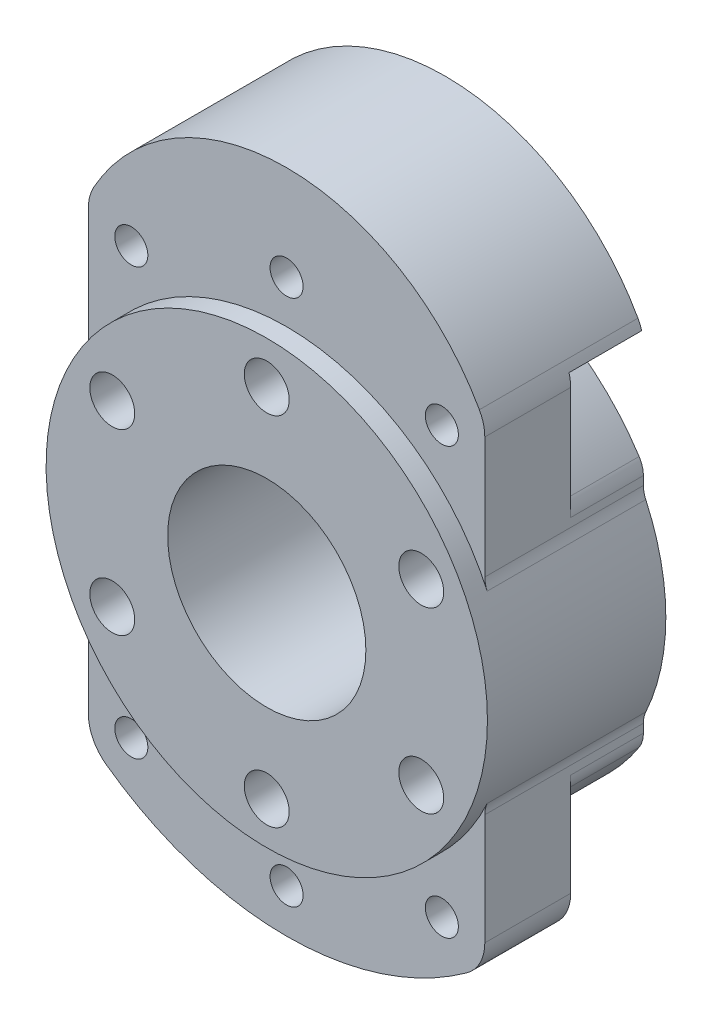
from build123d import *

# Parameters (mm, degrees)
EXTRUDE_1_DEPTH             = 0.7
EXTRUDE_2_DEPTH             = 5.5
EXTRUDE_3_DEPTH             = 6.5
SKETCH_4_R                  = 16.7
EXTRUDE_4_DEPTH             = 1.5
EXTRUDE_5_REACH             = 43.838
EXTRUDE_5_START_RADIUS      = 16.7
EXTRUDE_5_END_RADIUS        = 16.7
SKETCH_5_W                  = 30
SKETCH_5_H                  = 12
CUT_EXTRUDE_1_DEPTH         = 5.5
HOLE_WIZARD_2_5_2_5_1_D     = 2.5
HOLE_WIZARD_2_5_2_5_1_DEPTH = 8
HOLE_WIZARD_15_0_15_1_D     = 15
HOLE_WIZARD_15_0_15_1_DEPTH = 14.2
HOLE_WIZARD_3_4_3_4_1_D     = 3.4
HOLE_WIZARD_3_4_3_4_1_DEPTH = 14.2
FILLET_1_R                  = 0.5
FILLET_2_R                  = 2
FILLET_START                = 2
FILLET_3_DEPTH              = 14


with BuildPart() as part:
    # 草图1 → 凸台-拉伸1 (new body)
    with BuildSketch(Plane(origin=(0, 0, 2.3), x_dir=(-1, 0, 0), z_dir=(0, 0, -1))):
        with BuildLine():
            Line((5.499904708, -20.525923809), (4.529333289, -16.90370196))
            ThreePointArc((4.529333289, -16.90370196), (0, -17.5), (-4.529333289, -16.90370196))
            Line((-4.529333289, -16.90370196), (-5.499904708, -20.525923809))
            ThreePointArc((-5.499904708, -20.525923809), (-3.858782139, -20.896705492), (-2.193469574, -21.136489567))
            ThreePointArc((-2.193469574, -21.136489567), (-1.75352934, -20.954121421), (-1.665889964, -20.486013645))
            ThreePointArc((-1.665889964, -20.486013645), (0, -18.2), (1.665889964, -20.486013645))
            ThreePointArc((1.665889964, -20.486013645), (1.75352934, -20.954121421), (2.193469574, -21.136489567))
            ThreePointArc((2.193469574, -21.136489567), (3.858782139, -20.896705492), (5.499904708, -20.525923809))
        make_face()
    extrude(amount=-EXTRUDE_1_DEPTH)

    # 草图2 → 凸台-拉伸2 (add)
    with BuildSketch(Plane.XY.offset(3)):
        with BuildLine():
            Line((-15, -9.013878189), (-15, -7.340980861))
            ThreePointArc((-15, -7.340980861), (0, 16.7), (15, -7.340980861))
            Line((15, -7.340980861), (15, -9.013878189))
            ThreePointArc((15, -9.013878189), (12.1297479, -12.614246544), (8.419780607, -15.341358953))
            ThreePointArc((8.419780607, -15.341358953), (5.738930413, -14.290719986), (4.529333289, -16.90370196))
            Line((4.529333289, -16.90370196), (5.499904708, -20.525923809))
            ThreePointArc((5.499904708, -20.525923809), (3.858782139, -20.896705492), (2.193469574, -21.136489567))
            ThreePointArc((2.193469574, -21.136489567), (1.75352934, -20.954121421), (1.665889964, -20.486013645))
            ThreePointArc((1.665889964, -20.486013645), (0, -18.2), (-1.665889964, -20.486013645))
            ThreePointArc((-1.665889964, -20.486013645), (-1.75352934, -20.954121421), (-2.193469574, -21.136489567))
            ThreePointArc((-2.193469574, -21.136489567), (-3.858782139, -20.896705492), (-5.499904708, -20.525923809))
            Line((-5.499904708, -20.525923809), (-4.529333289, -16.90370196))
            ThreePointArc((-4.529333289, -16.90370196), (-5.738930413, -14.290719986), (-8.419780607, -15.341358953))
            ThreePointArc((-8.419780607, -15.341358953), (-12.1297479, -12.614246544), (-15, -9.013878189))
        make_face()
    extrude(amount=EXTRUDE_2_DEPTH)

    # 草图3 → 凸台-拉伸3 (add)
    with BuildSketch(Plane.XY.offset(8.5)):
        with BuildLine():
            Line((-15, -17.764078923), (-15, -7.340980861))
            ThreePointArc((-15, -7.340980861), (0, 16.7), (15, -7.340980861))
            Line((15, -7.340980861), (15, -17.764078923))
            ThreePointArc((15, -17.764078923), (0, -23.25), (-15, -17.764078923))
        make_face()
    extrude(amount=EXTRUDE_3_DEPTH)

    # 草图4 → 凸台-拉伸4 (add)
    with BuildSketch(Plane.XY.offset(15)):
        with Locations(Location((0, 0, 0), (0, 0, 206.077066929))):
            Circle(SKETCH_4_R)
    extrude(amount=EXTRUDE_4_DEPTH)

    # 凸台-拉伸5: from a cylinder face, 43.838 long prism both ways, kept between that surface and its translate by the depth
    extrude_5_start = Plane(origin=(0, 0, 9), z_dir=(0, 0, -1)) * Cylinder(EXTRUDE_5_START_RADIUS, 122.076, mode=Mode.PRIVATE)
    extrude_5_end = Plane(origin=(0, 10.423098063, 9), z_dir=(0, 0, -1)) * Cylinder(EXTRUDE_5_END_RADIUS, 122.076, mode=Mode.PRIVATE)
    # 草图5 → 凸台-拉伸5 (add, from a surface)
    with BuildSketch(Plane(origin=(0, -4.175, 0), x_dir=(1, 0, 0), z_dir=(0, 1, 0)), mode=Mode.PRIVATE) as extrude_5_sk1:
        with Locations((0, -9)):
            Rectangle(SKETCH_5_W, SKETCH_5_H)
    extrude_5_tool1 = extrude(extrude_5_sk1.sketch, amount=EXTRUDE_5_REACH, both=True, mode=Mode.PRIVATE)
    add(((extrude_5_tool1 - extrude_5_start) & extrude_5_end).solids().sort_by_distance((0, 12.55253, 9))[0])

    # 草图6 → 切除-拉伸1 (cut)
    with BuildSketch(Plane(origin=(0, 0, 3), x_dir=(-1, 0, 0), z_dir=(0, 0, -1))):
        with BuildLine():
            Line((15, 9.013878189), (15, 17.764078923))
            ThreePointArc((15, 17.764078923), (0, 23.25), (-15, 17.764078923))
            Line((-15, 17.764078923), (-15, 9.013878189))
            ThreePointArc((-15, 9.013878189), (0, 17.5), (15, 9.013878189))
        make_face()
    extrude(amount=-CUT_EXTRUDE_1_DEPTH, mode=Mode.SUBTRACT)

    # Ø2.5 (2.5) 直径孔1
    with Locations(Plane(origin=(0, 0, 8.5), x_dir=(-1, 0, 0), z_dir=(0, 0, -1))):
        with Locations((0, -19.95), (11.75, -16.122654868), (-11.75, -16.122654868), (-11.75, 16.122654868), (0, 19.95), (11.75, 16.122654868)):
            Hole(HOLE_WIZARD_2_5_2_5_1_D / 2, depth=HOLE_WIZARD_2_5_2_5_1_DEPTH)

    # Ø15.0 (15) 直径孔1
    with Locations(Plane.XY.offset(16.5)):
        with Locations((0, 0)):
            Hole(HOLE_WIZARD_15_0_15_1_D / 2, depth=HOLE_WIZARD_15_0_15_1_DEPTH)

    # Ø3.4 (3.4) 直径孔1
    with Locations(Plane.XY.offset(16.5)):
        with Locations((11.691342951, -6.75), (11.691342951, 6.75), (0, 13.5), (-11.691342951, 6.75), (-11.691342951, -6.75), (0, -13.5)):
            Hole(HOLE_WIZARD_3_4_3_4_1_D / 2, depth=HOLE_WIZARD_3_4_3_4_1_DEPTH)

    # 圆角1
    fillet_1_edges = [part.edges().sort_by_distance(p)[0] for p in [
        (5.499904708, -20.525923809, 5.4),
        (4.529333289, -16.90370196, 2.65),
        (-4.529333289, -16.90370196, 2.65),
        (-5.499904708, -20.525923809, 5.4),
        (-8.419780607, -15.341358953, 5.75),
        (8.419780607, -15.341358953, 5.75),
    ]]
    fillet(fillet_1_edges, radius=FILLET_1_R)

    # 圆角2
    # the kernel refuses this fillet: 2 mm, written as the material it adds along each edge
    with BuildSketch(Plane(origin=(15, -7.340980861, 3), x_dir=(0, -1, 0), z_dir=(0, 0, 1)), Plane(origin=(-15, -7.340980861, 15), x_dir=(0, -1, 0), z_dir=(0, 0, -1))) as fillet_2_piece_1:
        with BuildLine():
            CenterArc((0.449397821, 2), FILLET_2_R, 245.380022671, 24.619977329)
            ThreePointArc((-0.38379776, 0.181818182), (-0.191320895, 0.092129153), (0, 0))
            Line((0, 0), (0.449397821, 0))
        make_face()
    extrude(amount=12)
    with BuildSketch(Plane(origin=(-15, 7.340980861, 15), x_dir=(-0.4281233512586551, -0.9037203085618128, 0), z_dir=(0, 0, -1))) as fillet_2_piece_2:
        with BuildLine():
            CenterArc((0.450116765, 1.999838318), FILLET_2_R, 244.651477871, 24.619977329)
            Line((-0.406129937, 0.192397701), (0, 0))
            ThreePointArc((0, 0), (0.21234322, 0.001350044), (0.42468644, 0))
        make_face()
    extrude(amount=12)
    with BuildSketch(Plane(origin=(15, 7.340980861, 15), x_dir=(0.4281233512586662, -0.9037203085618076, 0), z_dir=(0, 0, -1))) as fillet_2_piece_3:
        with BuildLine():
            CenterArc((0.450116765, -1.999838318), FILLET_2_R, 90.7285448, 24.619977329)
            Line((-0.406129937, -0.192397701), (0, 0))
            ThreePointArc((0, 0), (0.21234322, -0.001350044), (0.42468644, 0))
        make_face()
    extrude(amount=12)
    # the kernel refuses this fillet: 2 mm, written as the material it takes off along each edge
    with BuildSketch(Plane(origin=(-15, 9.013878189, 1.478131702), x_dir=(0, -1, 0), z_dir=(0, 0, 1))) as fillet_2_2_piece_1:
        with BuildLine():
            CenterArc((0.572906681, 2), FILLET_2_R, 237.004114526, 32.995885474)
            ThreePointArc((-0.516250933, 0.322580645), (-0.259528216, 0.159045393), (0, 0))
            Line((0, 0), (0.572906681, 0))
        make_face()
    extrude(amount=7.021868298, mode=Mode.SUBTRACT)
    with BuildSketch(Plane(origin=(15, 9.013878189, 1.478131702), x_dir=(0, -1, 0), z_dir=(0, 0, 1)), Plane(origin=(-15, -9.013878189, 1.478131702), x_dir=(0, 1, 0), z_dir=(0, 0, 1))) as fillet_2_2_piece_2:
        with BuildLine():
            CenterArc((0.572906681, -2), FILLET_2_R, 90, 32.995885474)
            ThreePointArc((-0.516250933, -0.322580645), (-0.259528216, -0.159045393), (0, 0))
            Line((0, 0), (0.572906681, 0))
        make_face()
    extrude(amount=7.021868298, mode=Mode.SUBTRACT)
    with BuildSketch(Plane(origin=(15, -9.013878189, 1.478131702), x_dir=(-0.5299089374298662, -0.8480545489719102, 0), z_dir=(0, 0, 1))) as fillet_2_2_piece_3:
        with BuildLine():
            CenterArc((0.573961758, -1.999697468), FILLET_2_R, 89.00341683, 32.995885474)
            Line((-0.485856117, -0.30358837), (0, 0))
            ThreePointArc((0, 0), (0.30437366, 0.002647152), (0.608747319, 0))
        make_face()
    extrude(amount=7.021868298, mode=Mode.SUBTRACT)

    # 圆角3: read off the stored shape, not the designer's step
    # 圆角3 outline → 圆角3 (cut)
    with BuildSketch(Plane.XY.offset(FILLET_START)):
        with BuildLine():
            ThreePointArc((15, 17.764078923), (14.799825954, 18.159709189), (14.589219331, 18.549885824))
            ThreePointArc((14.589219331, 18.549885824), (14.895628938, 17.785343438), (15, 16.968325331))
            Line((15, 16.968325331), (15, 17.764078923))
        make_face()
        with BuildLine():
            ThreePointArc((-14.589219331, 18.549885824), (-14.799825954, 18.159709189), (-15, 17.764078923))
            Line((-15, 17.764078923), (-15, 16.968325331))
            ThreePointArc((-15, 16.968325331), (-14.895628938, 17.785343438), (-14.589219331, 18.549885824))
        make_face()
        with BuildLine():
            Line((15, -17.764078923), (15, -16.18448331))
            ThreePointArc((15, -16.18448331), (14.645511073, -17.660462857), (13.659375, -18.814461847))
            ThreePointArc((13.659375, -18.814461847), (14.339308558, -18.301549936), (15, -17.764078923))
        make_face()
        with BuildLine():
            ThreePointArc((-15, -17.764078923), (-14.339308558, -18.301549936), (-13.659375, -18.814461847))
            ThreePointArc((-13.659375, -18.814461847), (-14.645511073, -17.660462857), (-15, -16.18448331))
            Line((-15, -16.18448331), (-15, -17.764078923))
        make_face()
    extrude(amount=FILLET_3_DEPTH, mode=Mode.SUBTRACT)


solid = part.part
